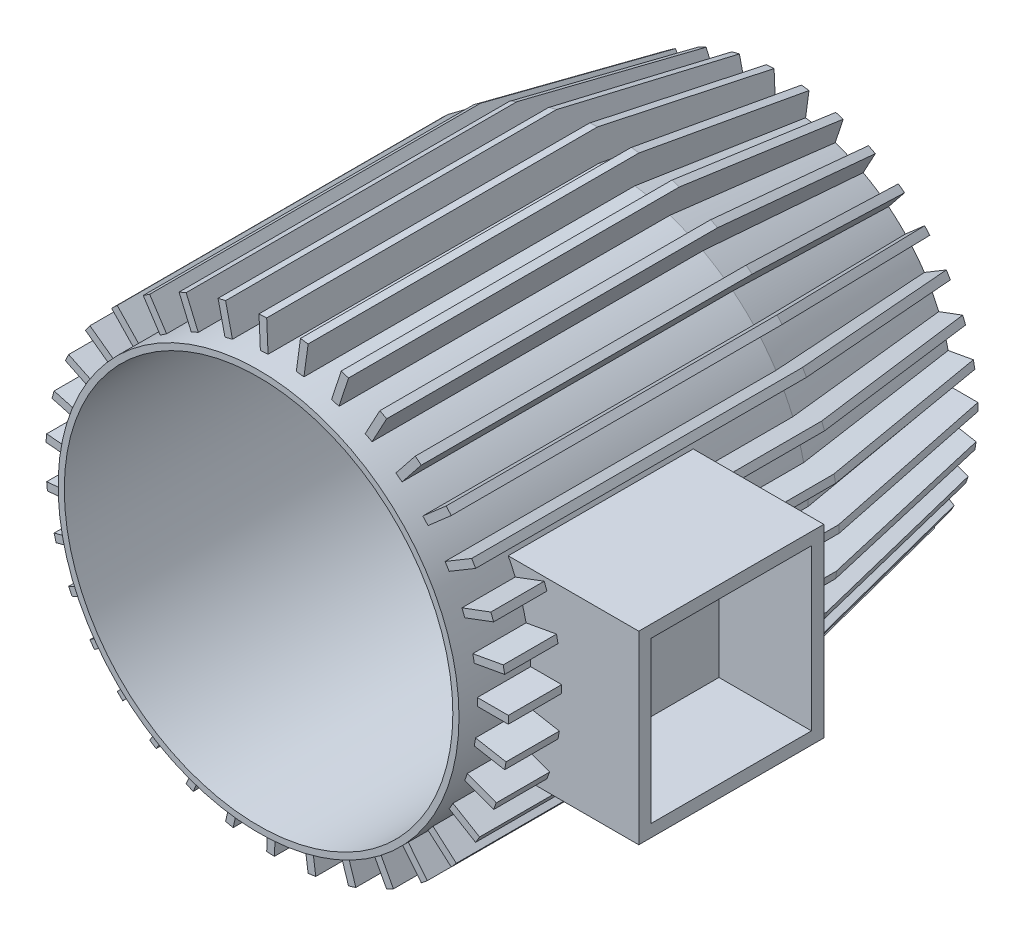
from build123d import *

# Parameters (mm, degrees)
SKETCH1_R           = 65
BOSS_EXTRUDE1_DEPTH = 170
CHAMFER4_SIZE       = 10
CHAMFER4_SIZE2      = 56.712818196
BOSS_EXTRUDE2_REACH = 231.619
SKETCH3_W           = 164
SKETCH3_H           = 2.5
CIRPATTERN1_COUNT   = 35
SKETCH5_R           = 10
CUT_EXTRUDE1_DEPTH  = 10
BOSS_EXTRUDE3_REACH = 257.202
SKETCH7_W           = 60
SKETCH7_H           = 60
SKETCH8_W           = 52
SKETCH8_H           = 52
CUT_EXTRUDE3_DEPTH  = 30


# Read off the part's stored shape, not the designer's step: Shell1
with BuildPart() as part:
    # Sketch1 → Boss-Extrude1 (new body)
    with BuildSketch(Plane.XY):
        Circle(SKETCH1_R)
    extrude(amount=-BOSS_EXTRUDE1_DEPTH)

    # Chamfer4
    chamfer4_edges = [part.edges().sort_by_distance(p)[0] for p in [
        (-65, 0, -170),
    ]]
    chamfer4_side = [part.faces().sort_by_distance(p)[0] for p in [
        (0, 0, -170),
    ]]
    chamfer(chamfer4_edges, length=CHAMFER4_SIZE, length2=CHAMFER4_SIZE2, reference=chamfer4_side[0])

    # Sketch3 → Boss-Extrude2 (add, up to next)
    with BuildSketch(Plane(origin=(75, 0, 0), x_dir=(0, 0, -1), z_dir=(1, 0, 0)), mode=Mode.PRIVATE) as boss_extrude2_sk1:
        with Locations((88, 1.25)):
            Rectangle(SKETCH3_W, SKETCH3_H)
    boss_extrude2_tool1 = extrude(boss_extrude2_sk1.sketch, amount=-BOSS_EXTRUDE2_REACH, mode=Mode.PRIVATE) - part.part
    boss_extrude2 = boss_extrude2_tool1.solids().sort_by_distance((75, 1.25, -88))[0]
    add(boss_extrude2)

    # CirPattern1: Boss-Extrude2 ×35 about axis
    cirpattern1_axis = Axis((0, 0, 0), (0, 0, 1))
    for i in range(1, CIRPATTERN1_COUNT):
        add(boss_extrude2.rotate(cirpattern1_axis, i * 360 / CIRPATTERN1_COUNT))

    # Shell1 outline → Shell1 (revolve, cut)
    with BuildSketch(Plane.XZ):
        Polygon((53.321800738, -168), (63, -113.112204477), (63, 0), (0, 0), (0, -168), align=None)
    revolve(axis=Axis((0, 0, 0), (0, 0, 1)), mode=Mode.SUBTRACT)

    # Sketch4 → Cut-Revolve1 (revolve, cut)
    with BuildSketch(Plane(origin=(0, 0, 0), x_dir=(1, 0, 0), z_dir=(0, 1, 0))):
        Polygon((-75, 182.236218024), (-60.757920877, 182.236218024), (-75, 113.287181804), (-83.512102344, 113.287181804), (-83.512102344, 182.236218024), align=None)
    revolve(axis=Axis((0, 0, 0), (0, 0, -1)), mode=Mode.SUBTRACT)

    # Sketch5 → Cut-Extrude1 (cut)
    with BuildSketch(Plane(origin=(0, 0, -170), x_dir=(-1, 0, 0), z_dir=(0, 0, -1))):
        Circle(SKETCH5_R)
    extrude(amount=-CUT_EXTRUDE1_DEPTH, mode=Mode.SUBTRACT)

    # Sketch7 → Boss-Extrude3 (add, up to next)
    with BuildSketch(Plane(origin=(100, 0, 0), x_dir=(0, 0, -1), z_dir=(1, 0, 0)), mode=Mode.PRIVATE) as boss_extrude3_sk1:
        with Locations((53.287181804, 0)):
            Rectangle(SKETCH7_W, SKETCH7_H)
    boss_extrude3_tool1 = extrude(boss_extrude3_sk1.sketch, amount=-BOSS_EXTRUDE3_REACH, mode=Mode.PRIVATE) - part.part
    add(boss_extrude3_tool1.solids().sort_by_distance((100, 0, -53.287182))[0])

    # Sketch8 → Cut-Extrude3 (cut)
    with BuildSketch(Plane(origin=(100, 0, 0), x_dir=(0, 0, -1), z_dir=(1, 0, 0))):
        with Locations((53.287181804, 0)):
            Rectangle(SKETCH8_W, SKETCH8_H)
    extrude(amount=-CUT_EXTRUDE3_DEPTH, mode=Mode.SUBTRACT)


solid = part.part
